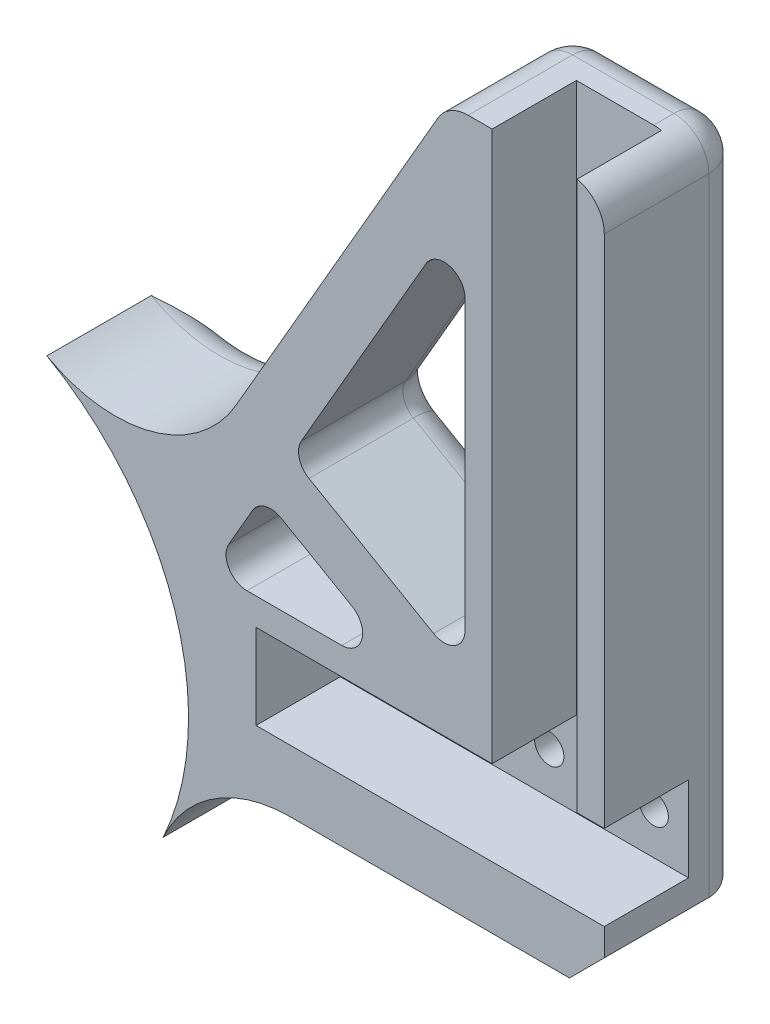
from build123d import *

# Parameters (mm, degrees)
SKETCH_1_R          = 40
SKETCH_1_R_2        = 32.5
EXTRUDE_1_DEPTH     = 20
EXTRUDE_START       = -20
SKETCH_4_R          = 1.55
EXTRUDE_2_DEPTH     = 20
FILLET_2_R          = 20
CHAMFER_1_SIZE      = 5
FILLET_4_R          = 3
FILLET_5_R          = 5
SKETCH_6_R          = 40
CUT_EXTRUDE_1_DEPTH = 140.14866999
CUT_EXTRUDE_2_DEPTH = 12.1
SKETCH_8_R          = 2.1
SKETCH_8_R_2        = 2.05
CUT_EXTRUDE_3_DEPTH = 4.5
SKETCH_9_R          = 1.55
EXTRUDE_3_DEPTH     = 3.4
FILLET_6_R          = 5


with BuildPart() as part:
    # 草图1 → 凸台-拉伸1 (new body)
    with BuildSketch(Plane.XY):
        Circle(SKETCH_1_R)
        Circle(SKETCH_1_R_2, mode=Mode.SUBTRACT)
    extrude(amount=EXTRUDE_1_DEPTH)

    # 草图4 → 凸台-拉伸2 (add)
    with BuildSketch(Plane.XY.offset(20).offset(EXTRUDE_START)):
        with BuildLine():
            Line((39.686269666, -5), (99.686269666, -5))
            Line((99.686269666, -5), (99.686269666, 95))
            Line((99.686269666, 95), (77.249935548, 95))
            Line((77.249935548, 95), (34.29141524, 20.593660209))
            ThreePointArc((34.29141524, 20.593660209), (39.139919861, 8.25025292), (39.686269666, -5))
        make_face()
        with Locations((79.686269666, 10)):
            Circle(SKETCH_4_R, mode=Mode.SUBTRACT)
        with Locations((94.686269666, 10)):
            Circle(SKETCH_4_R, mode=Mode.SUBTRACT)
        with Locations((64.686269666, 10)):
            Circle(SKETCH_4_R, mode=Mode.SUBTRACT)
        with Locations((89.686269666, 76)):
            Circle(SKETCH_4_R, mode=Mode.SUBTRACT)
        with Locations((89.686269666, 61)):
            Circle(SKETCH_4_R, mode=Mode.SUBTRACT)
        with Locations((89.686269666, 46)):
            Circle(SKETCH_4_R, mode=Mode.SUBTRACT)
        with Locations((89.686269666, 31)):
            Circle(SKETCH_4_R, mode=Mode.SUBTRACT)
        Polygon((54.686269666, 39.918584287), (79.686269666, 25.484827557), (79.686269666, 83.219854476), align=None, mode=Mode.SUBTRACT)
        Polygon((50.686269666, 32.990381057), (73.186269666, 20), (43.186269666, 20), align=None, mode=Mode.SUBTRACT)
    extrude(amount=EXTRUDE_2_DEPTH)

    # 圆角2
    fillet_2_edges = [part.edges().sort_by_distance(p)[0] for p in [
        (34.29141524, 20.593660209, 10),
        (39.686269666, -5, 10),
    ]]
    fillet(fillet_2_edges, radius=FILLET_2_R)

    # 倒角1
    chamfer_1_edges = [part.edges().sort_by_distance(p)[0] for p in [
        (99.686269666, -5, 10),
    ]]
    chamfer(chamfer_1_edges, length=CHAMFER_1_SIZE)

    # 圆角4
    fillet_4_edges = [part.edges().sort_by_distance(p)[0] for p in [
        (54.686269666, 39.918584287, 10),
        (79.686269666, 25.484827557, 10),
        (79.686269666, 83.219854476, 10),
        (73.186269666, 20, 10),
        (50.686269666, 32.990381057, 10),
        (43.186269666, 20, 10),
    ]]
    fillet(fillet_4_edges, radius=FILLET_4_R)

    # 圆角5
    fillet_5_edges = [part.edges().sort_by_distance(p)[0] for p in [
        (77.249935548, 95, 10),
        (99.686269666, 95, 10),
    ]]
    fillet(fillet_5_edges, radius=FILLET_5_R)

    # 草图6 → 切除-拉伸1 (cut, through all)
    with BuildSketch(Plane.XY.offset(20)):
        Circle(SKETCH_6_R)
    extrude(amount=-CUT_EXTRUDE_1_DEPTH, mode=Mode.SUBTRACT)

    # 草图7 → 切除-拉伸2 (cut)
    with BuildSketch(Plane.XY.offset(20)):
        Polygon((49.686269666, 16.1), (83.586269666, 16.1), (83.586269666, 95), (95.786269666, 95), (95.786269666, 16.1), (99.686269666, 16.1), (99.686269666, 3.9), (49.686269666, 3.9), align=None)
    extrude(amount=-CUT_EXTRUDE_2_DEPTH, mode=Mode.SUBTRACT)

    # 草图8 → 切除-拉伸3 (cut)
    with BuildSketch(Plane.XY.offset(7.9)):
        with Locations((94.686269666, 10)):
            Circle(SKETCH_8_R)
        with Locations((89.686269666, 31)):
            Circle(SKETCH_8_R)
        with Locations((79.686269666, 10)):
            Circle(SKETCH_8_R)
        with Locations((64.686269666, 10)):
            Circle(SKETCH_8_R)
        with Locations((89.686269666, 46)):
            Circle(SKETCH_8_R_2)
        with Locations((89.686269666, 61)):
            Circle(SKETCH_8_R_2)
        with Locations((89.686269666, 76)):
            Circle(SKETCH_8_R_2)
    extrude(amount=-CUT_EXTRUDE_3_DEPTH, mode=Mode.SUBTRACT)

    # 草图9 → 凸台-拉伸3 (add)
    with BuildSketch(Plane(origin=(0, 0, 0), x_dir=(-1, 0, 0), z_dir=(0, 0, -1))):
        with Locations((-89.686269666, 76)):
            Circle(SKETCH_9_R)
        with Locations((-89.686269666, 61)):
            Circle(SKETCH_9_R)
        with Locations((-89.686269666, 46)):
            Circle(SKETCH_9_R)
        with Locations((-89.686269666, 31)):
            Circle(SKETCH_9_R)
        with Locations((-79.686269666, 10)):
            Circle(SKETCH_9_R)
        with Locations((-64.686269666, 10)):
            Circle(SKETCH_9_R)
        with Locations((-94.686269666, 10)):
            Circle(SKETCH_9_R)
    extrude(amount=-EXTRUDE_3_DEPTH)

    # 圆角6
    # the kernel refuses this fillet: 5 mm, written as the material it takes off along each edge
    with BuildSketch(Plane(origin=(94.686269666, 95, 0), x_dir=(0, -1, 0), z_dir=(-1, 0, 0))) as fillet_6_piece_1:
        with BuildLine():
            CenterArc((FILLET_6_R, FILLET_6_R), FILLET_6_R, 180, 90)
            Line((0, FILLET_6_R), (0, 0))
            Line((0, 0), (FILLET_6_R, 0))
        make_face()
    extrude(amount=14.549582772, mode=Mode.SUBTRACT)
    with BuildSketch(Plane(origin=(99.686269666, -12.5, 0), x_dir=(-1, 0, 0), z_dir=(0, 1, 0))) as fillet_6_piece_2:
        with BuildLine():
            CenterArc((FILLET_6_R, FILLET_6_R), FILLET_6_R, 180, 90)
            Line((0, FILLET_6_R), (0, 0))
            Line((0, 0), (FILLET_6_R, 0))
        make_face()
    extrude(amount=102.5, mode=Mode.SUBTRACT)
    with BuildSketch(Plane(origin=(94.686269666, 90, 0), x_dir=(1, 0, 0), z_dir=(0, -1, 0))) as fillet_6_piece_3:
        with BuildLine():
            CenterArc((5 - FILLET_6_R, FILLET_6_R), FILLET_6_R, 270, 90)
            Line((5, FILLET_6_R), (5, 0))
            Line((5, 0), (5 - FILLET_6_R, 0))
        make_face()
    revolve(axis=Axis((94.686269666, 90, 0), (0, 0, 1)), revolution_arc=90, mode=Mode.SUBTRACT)
    with BuildSketch(Plane(origin=(80.136686894, 90, 0), x_dir=(0, 1, 0), z_dir=(1, 0, 0))) as fillet_6_piece_4:
        with BuildLine():
            CenterArc((5 - FILLET_6_R, FILLET_6_R), FILLET_6_R, 270, 90)
            Line((5, FILLET_6_R), (5, 0))
            Line((5, 0), (5 - FILLET_6_R, 0))
        make_face()
    revolve(axis=Axis((80.136686894, 90, 0), (0, 0, 1)), revolution_arc=60, mode=Mode.SUBTRACT)
    with BuildSketch(Plane(origin=(75.806559875, 92.5, 0), x_dir=(0.866025403784436, -0.5000000000000043, 0), z_dir=(-0.5000000000000043, -0.8660254037844362, 0))) as fillet_6_piece_5:
        with BuildLine():
            CenterArc((FILLET_6_R, FILLET_6_R), FILLET_6_R, 180, 90)
            Line((0, FILLET_6_R), (0, 0))
            Line((0, 0), (FILLET_6_R, 0))
        make_face()
    extrude(amount=58.013625798, mode=Mode.SUBTRACT)
    with BuildSketch(Plane(origin=(29.479238901, 52.258726294, 0), x_dir=(-0.9081540300879987, -0.4186361876796205, 0), z_dir=(-0.4186361876796205, 0.9081540300879987, 0))) as fillet_6_piece_6:
        with BuildLine():
            CenterArc((20 + FILLET_6_R, FILLET_6_R), FILLET_6_R, 180, 90)
            Line((20, FILLET_6_R), (20, 0))
            Line((20, 0), (20 + FILLET_6_R, 0))
        make_face()
    revolve(axis=Axis((29.479238901, 52.258726294, 0), (0, 0, 1)), revolution_arc=125.251485778, mode=Mode.SUBTRACT)
    with BuildSketch(Plane(origin=(54.543560573, -25, 0), x_dir=(-0.9809784270668743, -0.19411678348200886, 0), z_dir=(0.19411678348200886, -0.9809784270668743, 0))) as fillet_6_piece_7:
        with BuildLine():
            CenterArc((20 + FILLET_6_R, -FILLET_6_R), FILLET_6_R, 90, 90)
            Line((20, -FILLET_6_R), (20, 0))
            Line((20, 0), (20 + FILLET_6_R, 0))
        make_face()
    revolve(axis=Axis((54.543560573, -25, 0), (0, 0, -1)), revolution_arc=101.193133167, mode=Mode.SUBTRACT)
    with BuildSketch(Plane(origin=(54.543560573, -5, 0), x_dir=(0, 1, 0), z_dir=(1, 0, 0))) as fillet_6_piece_8:
        with BuildLine():
            CenterArc((FILLET_6_R, FILLET_6_R), FILLET_6_R, 180, 90)
            Line((0, FILLET_6_R), (0, 0))
            Line((0, 0), (FILLET_6_R, 0))
        make_face()
    extrude(amount=52.642709093, mode=Mode.SUBTRACT)
    with BuildSketch(Plane(origin=(85.847434901, -13.838834765, 0), x_dir=(-0.7071067811865476, 0.7071067811865476, 0), z_dir=(0.7071067811865476, 0.7071067811865476, 0))) as fillet_6_piece_9:
        with BuildLine():
            CenterArc((FILLET_6_R, FILLET_6_R), FILLET_6_R, 180, 90)
            Line((0, FILLET_6_R), (0, 0))
            Line((0, 0), (FILLET_6_R, 0))
        make_face()
    extrude(amount=32.071067812, mode=Mode.SUBTRACT)
    with BuildSketch(Plane(origin=(61.990117243, 20, 0), x_dir=(0, -1, 0), z_dir=(-1, 0, 0))) as fillet_6_piece_10:
        with BuildLine():
            CenterArc((FILLET_6_R, FILLET_6_R), FILLET_6_R, 180, 90)
            Line((0, FILLET_6_R), (0, 0))
            Line((0, 0), (FILLET_6_R, 0))
        make_face()
    extrude(amount=13.607695155, mode=Mode.SUBTRACT)
    with BuildSketch(Plane(origin=(45.784345877, 24.5, 0), x_dir=(-0.8660254037844366, 0.5000000000000036, 0), z_dir=(0.5000000000000036, 0.8660254037844366, 0))) as fillet_6_piece_11:
        with BuildLine():
            CenterArc((FILLET_6_R, FILLET_6_R), FILLET_6_R, 180, 90)
            Line((0, FILLET_6_R), (0, 0))
            Line((0, 0), (FILLET_6_R, 0))
        make_face()
    extrude(amount=6.803847577, mode=Mode.SUBTRACT)
    with BuildSketch(Plane(origin=(53.284345877, 31.490381057, 0), x_dir=(0.5000000000000044, 0.8660254037844362, 0), z_dir=(0.8660254037844362, -0.5000000000000044, 0))) as fillet_6_piece_12:
        with BuildLine():
            CenterArc((FILLET_6_R, FILLET_6_R), FILLET_6_R, 180, 90)
            Line((0, FILLET_6_R), (0, 0))
            Line((0, 0), (FILLET_6_R, 0))
        make_face()
    extrude(amount=11.784609691, mode=Mode.SUBTRACT)
    with BuildSketch(Plane(origin=(57.284345877, 38.418584287, 0), x_dir=(-0.5000000000000043, -0.8660254037844362, 0), z_dir=(0.8660254037844362, -0.5000000000000043, 0))) as fillet_6_piece_13:
        with BuildLine():
            CenterArc((FILLET_6_R, -FILLET_6_R), FILLET_6_R, 90, 90)
            Line((0, -FILLET_6_R), (0, 0))
            Line((0, 0), (FILLET_6_R, 0))
        make_face()
    extrude(amount=20.671361037, mode=Mode.SUBTRACT)
    with BuildSketch(Plane(origin=(74.088193455, 73.523702054, 0), x_dir=(-0.8660254037844362, 0.5000000000000044, 0), z_dir=(-0.5000000000000044, -0.8660254037844362, 0))) as fillet_6_piece_14:
        with BuildLine():
            CenterArc((FILLET_6_R, -FILLET_6_R), FILLET_6_R, 90, 90)
            Line((0, -FILLET_6_R), (0, 0))
            Line((0, 0), (FILLET_6_R, 0))
        make_face()
    extrude(amount=35.803847577, mode=Mode.SUBTRACT)
    with BuildSketch(Plane(origin=(79.686269666, 30.68097998, 0), x_dir=(1, 0, 0), z_dir=(0, 1, 0))) as fillet_6_piece_15:
        with BuildLine():
            CenterArc((FILLET_6_R, -FILLET_6_R), FILLET_6_R, 90, 90)
            Line((0, -FILLET_6_R), (0, 0))
            Line((0, 0), (FILLET_6_R, 0))
        make_face()
    extrude(amount=41.342722074, mode=Mode.SUBTRACT)
    with BuildSketch(Plane(origin=(48.382422089, 23, 0), x_dir=(-0.8660254037844359, 0.5000000000000046, 0), z_dir=(0.5000000000000046, 0.8660254037844359, 0))) as fillet_6_piece_16:
        with BuildLine():
            CenterArc((3 + FILLET_6_R, FILLET_6_R), FILLET_6_R, 180, 90)
            Line((3, FILLET_6_R), (3, 0))
            Line((3, 0), (3 + FILLET_6_R, 0))
        make_face()
    revolve(axis=Axis((48.382422089, 23, 0), (0, 0, 1)), revolution_arc=120, mode=Mode.SUBTRACT)
    with BuildSketch(Plane(origin=(51.784345877, 28.892304845, 0), x_dir=(-0.8660254037844369, 0.5000000000000028, 0), z_dir=(-0.5000000000000028, -0.8660254037844369, 0))) as fillet_6_piece_17:
        with BuildLine():
            CenterArc((3 + FILLET_6_R, -FILLET_6_R), FILLET_6_R, 90, 90)
            Line((3, -FILLET_6_R), (3, 0))
            Line((3, 0), (3 + FILLET_6_R, 0))
        make_face()
    revolve(axis=Axis((51.784345877, 28.892304845, 0), (0, 0, -1)), revolution_arc=90, mode=Mode.SUBTRACT)
    with BuildSketch(Plane(origin=(61.990117243, 23, 0), x_dir=(0.5000000000000046, 0.866025403784436, 0), z_dir=(-0.866025403784436, 0.5000000000000046, 0))) as fillet_6_piece_18:
        with BuildLine():
            CenterArc((3 + FILLET_6_R, -FILLET_6_R), FILLET_6_R, 90, 90)
            Line((3, -FILLET_6_R), (3, 0))
            Line((3, 0), (3 + FILLET_6_R, 0))
        make_face()
    revolve(axis=Axis((61.990117243, 23, 0), (0, 0, -1)), revolution_arc=150, mode=Mode.SUBTRACT)
    with BuildSketch(Plane(origin=(58.784345877, 41.016660498, 0), x_dir=(-0.8660254037844359, 0.5000000000000046, 0), z_dir=(0.5000000000000046, 0.8660254037844359, 0))) as fillet_6_piece_19:
        with BuildLine():
            CenterArc((3 + FILLET_6_R, FILLET_6_R), FILLET_6_R, 180, 90)
            Line((3, FILLET_6_R), (3, 0))
            Line((3, 0), (3 + FILLET_6_R, 0))
        make_face()
    revolve(axis=Axis((58.784345877, 41.016660498, 0), (0, 0, 1)), revolution_arc=90, mode=Mode.SUBTRACT)
    with BuildSketch(Plane(origin=(76.686269666, 72.023702054, 0), x_dir=(-0.8660254037844354, 0.5000000000000056, 0), z_dir=(-0.5000000000000056, -0.8660254037844354, 0))) as fillet_6_piece_20:
        with BuildLine():
            CenterArc((3 + FILLET_6_R, -FILLET_6_R), FILLET_6_R, 90, 90)
            Line((3, -FILLET_6_R), (3, 0))
            Line((3, 0), (3 + FILLET_6_R, 0))
        make_face()
    revolve(axis=Axis((76.686269666, 72.023702054, 0), (0, 0, -1)), revolution_arc=150, mode=Mode.SUBTRACT)
    with BuildSketch(Plane(origin=(76.686269666, 30.68097998, 0), x_dir=(1, 0, 0), z_dir=(0, 1, 0))) as fillet_6_piece_21:
        with BuildLine():
            CenterArc((3 + FILLET_6_R, -FILLET_6_R), FILLET_6_R, 90, 90)
            Line((3, -FILLET_6_R), (3, 0))
            Line((3, 0), (3 + FILLET_6_R, 0))
        make_face()
    revolve(axis=Axis((76.686269666, 30.68097998, 0), (0, 0, -1)), revolution_arc=120, mode=Mode.SUBTRACT)


solid = part.part
